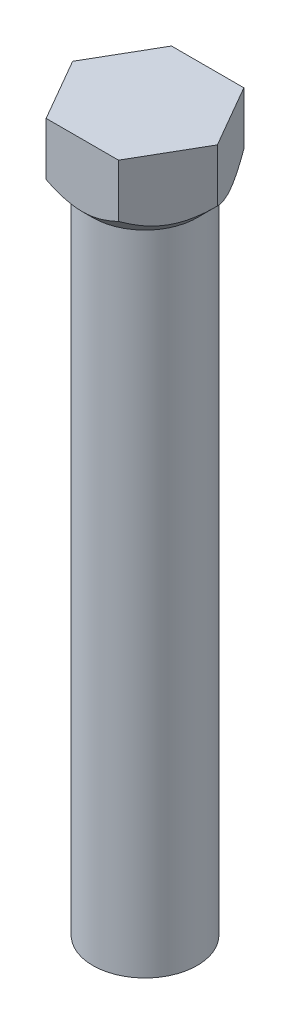
from build123d import *

# Parameters (mm, degrees)
SKETCH1_R           = 2.5
BOSS_EXTRUDE1_DEPTH = 32
BOSS_EXTRUDE2_DEPTH = 2.5
CHAMFER2_SIZE       = 1


with BuildPart() as part:
    # Sketch1 → Boss-Extrude1 (new body)
    with BuildSketch(Plane(origin=(0, 0, 0), x_dir=(1, 0, 0), z_dir=(0, 1, 0))):
        with Locations(Location((0, 0, 0), (0, 0, 270))):
            Circle(SKETCH1_R)
    extrude(amount=BOSS_EXTRUDE1_DEPTH)

    # Sketch2 → Boss-Extrude2 (add)
    with BuildSketch(Plane(origin=(0, 32, 0), x_dir=(1, 0, 0), z_dir=(0, 1, 0))):
        Polygon((3.464101615, 0), (1.732050808, 3), (-1.732050808, 3), (-3.464101615, 0), (-1.732050808, -3), (1.732050808, -3), align=None)
    extrude(amount=BOSS_EXTRUDE2_DEPTH)

    # Chamfer2
    # the kernel refuses this chamfer: 1 mm, written as the material it adds along each edge
    with BuildSketch(Plane(origin=(0, 32, 0), x_dir=(0, 0, 1), z_dir=(-1, 0, 0))) as chamfer2_piece_1_section:
        Polygon((2.5 + CHAMFER2_SIZE, 0), (2.5, -CHAMFER2_SIZE), (2.5, 0), align=None)
    chamfer2_piece_1 = revolve(axis=Axis((0, 32, 0), (0, 1, 0)), mode=Mode.PRIVATE)
    chamfer2_piece_1 = split(chamfer2_piece_1, bisect_by=Plane(origin=(1.319077429, 31.482096177, -3.715290874), z_dir=(-0.8660254037844386, 0, 0.5000000000000002)), keep=Keep.TOP, mode=Mode.PRIVATE)
    chamfer2_piece_1 = split(chamfer2_piece_1, bisect_by=Plane(origin=(3.877074994, 31.482096177, -0.715290874), z_dir=(-0.8660254037844389, 0, -0.4999999999999996)), keep=Keep.TOP, mode=Mode.PRIVATE)
    chamfer2_piece_1 = split(chamfer2_piece_1, bisect_by=Plane(origin=(0, 31.482096177, -3), z_dir=(0, 0, 1)), keep=Keep.TOP, mode=Mode.PRIVATE)
    chamfer2_piece_1 = split(chamfer2_piece_1, bisect_by=Plane(origin=(0, 31.482096177, 3), z_dir=(0, 0, -1)), keep=Keep.TOP, mode=Mode.PRIVATE)
    chamfer2_piece_1 = split(chamfer2_piece_1, bisect_by=Plane(origin=(-1.319077429, 31.482096177, -3.715290874), z_dir=(0.8660254037844387, 0, 0.5)), keep=Keep.TOP, mode=Mode.PRIVATE)
    chamfer2_piece_1 = split(chamfer2_piece_1, bisect_by=Plane(origin=(-3.877074994, 31.482096177, -0.715290874), z_dir=(0.8660254037844386, 0, -0.5000000000000001)), keep=Keep.TOP, mode=Mode.PRIVATE)
    add(chamfer2_piece_1)


solid = part.part
